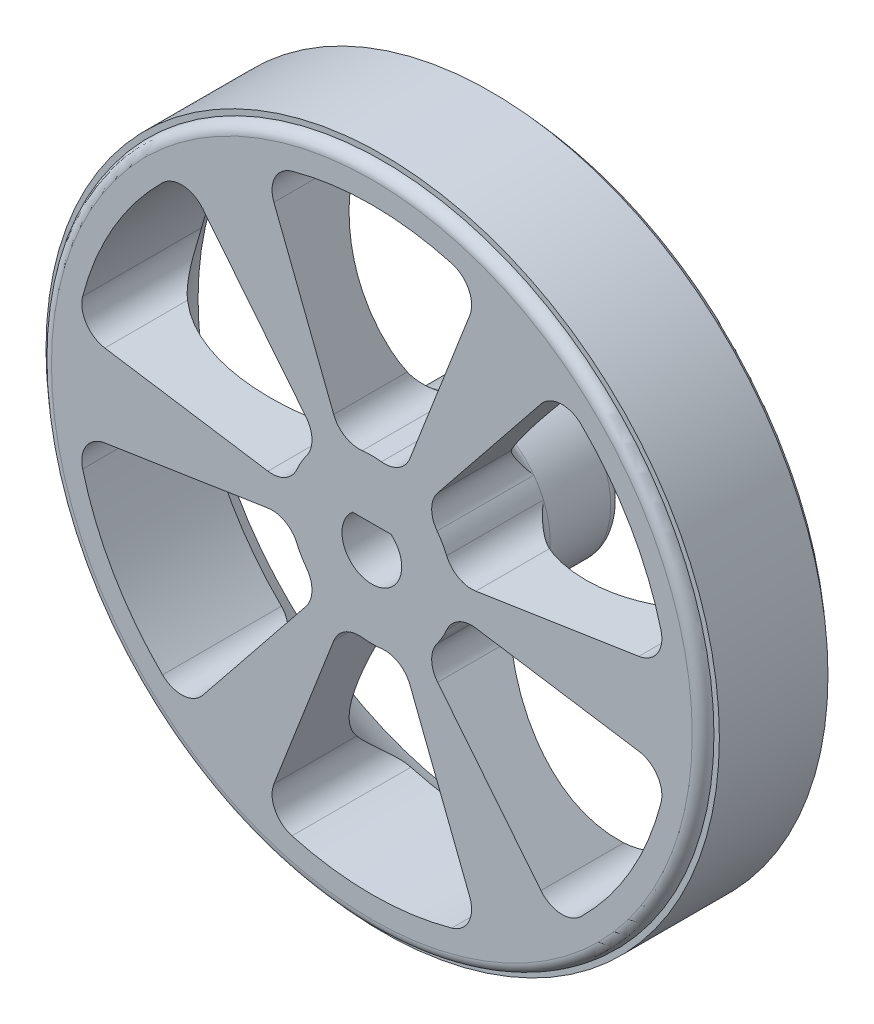
from build123d import *

# Parameters (mm, degrees)
ENL_V_MAT_EXTRU_1_DEPTH      = 46.83393939
ENL_V_MAT_EXTRU_1_DEPTH_BACK = 46.83393939
ESQUISSE3_OUTSIDE_W          = 80.53
ESQUISSE3_OUTSIDE_H          = 80.53
ESQUISSE3_OUTSIDE_R          = 30.5
ENL_V_MAT_EXTRU_2_DEPTH      = 46.833939424
CONG_1_R                     = 1
CONG_2_R                     = 1
ESQUISSE5_W                  = 10
ESQUISSE5_H                  = 1
ESQUISSE6_R                  = 1.55
ENL_V_MAT_EXTRU_3_DEPTH      = 10
ENL_V_START                  = 4.6
ENL_V_MAT_EXTRU_4_DEPTH      = 10


with BuildPart() as part:
    # Esquisse2 → Révolution1 (revolve)
    with BuildSketch(Plane(origin=(0, 0, 0), x_dir=(0, 0, -1), z_dir=(1, 0, 0)), mode=Mode.PRIVATE) as r_volution1_sk:
        with BuildLine():
            Line((0, 30.5), (0, 0))
            Line((0, 0), (15.5, 0))
            Line((15.5, 0), (15.5, 7.5))
            Line((15.5, 7.5), (8.918042609, 7.5))
            add(Edge.make_bspline(
                [(12, 28), (0.252176706, 23.0109808), (6.249286055, 7.481683521), (8.918042609, 7.5)],
                knots=[0, 0, 0, 0, 1, 1, 1, 1], degree=3))
            Line((12, 28), (12, 30.5))
            Line((12, 30.5), (11, 30.5))
            Line((11, 30.5), (11, 30))
            Line((11, 30), (1, 30))
            Line((1, 30), (1, 30.5))
            Line((1, 30.5), (0, 30.5))
        make_face()
    revolve(r_volution1_sk.sketch.rotate(Axis((0, 0, -15.5), (0, 0, 1)), 90), axis=Axis((0, 0, -15.5), (0, 0, 1)))

    # Esquisse3 outside → Enlèv. mat.-Extru.1 (cut, two sides: drawn at the far end of the back side and taken through both)
    # profile 1 of 7: a face of its own
    with BuildSketch(Plane.XY.offset(-ENL_V_MAT_EXTRU_1_DEPTH_BACK)):
        Rectangle(ESQUISSE3_OUTSIDE_W, ESQUISSE3_OUTSIDE_H)
        with Locations(Location((0, 0, 0), (0, 0, 180))):
            Circle(ESQUISSE3_OUTSIDE_R, mode=Mode.SUBTRACT)
    # profile 2 of 7: a face of its own
    with BuildSketch(Plane.XY.offset(-ENL_V_MAT_EXTRU_1_DEPTH_BACK)):
        with BuildLine():
            Line((-9.015532371, 23.183403031), (-3.509291216, 9.024127391))
            ThreePointArc((-3.509291216, 9.024127391), (-2.466446172, 7.787051594), (-0.884453657, 7.447666865))
            ThreePointArc((-0.884453657, 7.447666865), (0, 7.5), (0.884453657, 7.447666865))
            ThreePointArc((0.884453657, 7.447666865), (2.466446172, 7.787051594), (3.509291216, 9.024127391))
            Line((3.509291216, 9.024127391), (9.015532371, 23.183403031))
            ThreePointArc((9.015532371, 23.183403031), (8.920515519, 25.209659895), (7.354063967, 26.498447939))
            ThreePointArc((7.354063967, 26.498447939), (0, 27.5), (-7.354063967, 26.498447939))
            ThreePointArc((-7.354063967, 26.498447939), (-8.920515519, 25.209659895), (-9.015532371, 23.183403031))
        make_face()
    # profile 3 of 7: a face of its own
    with BuildSketch(Plane.XY.offset(-ENL_V_MAT_EXTRU_1_DEPTH_BACK)):
        with BuildLine():
            Line((9.569769175, 1.472928353), (24.585182156, 3.784021454))
            ThreePointArc((24.585182156, 3.784021454), (26.292463649, 4.879436894), (26.625361059, 6.880417753))
            ThreePointArc((26.625361059, 6.880417753), (23.815698604, 13.75), (19.271297092, 19.618030186))
            ThreePointArc((19.271297092, 19.618030186), (17.371948131, 20.330223002), (15.569649785, 19.399381577))
            Line((15.569649785, 19.399381577), (6.060477959, 7.551199037))
            ThreePointArc((6.060477959, 7.551199037), (5.510561415, 6.029530839), (6.007641875, 4.489792768))
            ThreePointArc((6.007641875, 4.489792768), (6.495190528, 3.75), (6.892095532, 2.957874097))
            ThreePointArc((6.892095532, 2.957874097), (7.977007587, 1.757520755), (9.569769175, 1.472928353))
        make_face()
    # profile 4 of 7: a face of its own
    with BuildSketch(Plane.XY.offset(-ENL_V_MAT_EXTRU_1_DEPTH_BACK)):
        with BuildLine():
            Line((6.060477959, -7.551199037), (15.569649785, -19.399381577))
            ThreePointArc((15.569649785, -19.399381577), (17.371948131, -20.330223002), (19.271297092, -19.618030186))
            ThreePointArc((19.271297092, -19.618030186), (23.815698604, -13.75), (26.625361059, -6.880417753))
            ThreePointArc((26.625361059, -6.880417753), (26.292463649, -4.879436894), (24.585182156, -3.784021454))
            Line((24.585182156, -3.784021454), (9.569769175, -1.472928353))
            ThreePointArc((9.569769175, -1.472928353), (7.977007587, -1.757520755), (6.892095532, -2.957874097))
            ThreePointArc((6.892095532, -2.957874097), (6.495190528, -3.75), (6.007641875, -4.489792768))
            ThreePointArc((6.007641875, -4.489792768), (5.510561415, -6.029530839), (6.060477959, -7.551199037))
        make_face()
    # profile 5 of 7: a face of its own
    with BuildSketch(Plane.XY.offset(-ENL_V_MAT_EXTRU_1_DEPTH_BACK)):
        with BuildLine():
            Line((-3.509291216, -9.024127391), (-9.015532371, -23.183403031))
            ThreePointArc((-9.015532371, -23.183403031), (-8.920515519, -25.209659895), (-7.354063967, -26.498447939))
            ThreePointArc((-7.354063967, -26.498447939), (0, -27.5), (7.354063967, -26.498447939))
            ThreePointArc((7.354063967, -26.498447939), (8.920515519, -25.209659895), (9.015532371, -23.183403031))
            Line((9.015532371, -23.183403031), (3.509291216, -9.024127391))
            ThreePointArc((3.509291216, -9.024127391), (2.466446172, -7.787051594), (0.884453657, -7.447666865))
            ThreePointArc((0.884453657, -7.447666865), (0, -7.5), (-0.884453657, -7.447666865))
            ThreePointArc((-0.884453657, -7.447666865), (-2.466446172, -7.787051594), (-3.509291216, -9.024127391))
        make_face()
    # profile 6 of 7: a face of its own
    with BuildSketch(Plane.XY.offset(-ENL_V_MAT_EXTRU_1_DEPTH_BACK)):
        with BuildLine():
            Line((-9.569769175, -1.472928353), (-24.585182156, -3.784021454))
            ThreePointArc((-24.585182156, -3.784021454), (-26.292463649, -4.879436894), (-26.625361059, -6.880417753))
            ThreePointArc((-26.625361059, -6.880417753), (-23.815698604, -13.75), (-19.271297092, -19.618030186))
            ThreePointArc((-19.271297092, -19.618030186), (-17.371948131, -20.330223002), (-15.569649785, -19.399381577))
            Line((-15.569649785, -19.399381577), (-6.060477959, -7.551199037))
            ThreePointArc((-6.060477959, -7.551199037), (-5.510561415, -6.029530839), (-6.007641875, -4.489792768))
            ThreePointArc((-6.007641875, -4.489792768), (-6.495190528, -3.75), (-6.892095532, -2.957874097))
            ThreePointArc((-6.892095532, -2.957874097), (-7.977007587, -1.757520755), (-9.569769175, -1.472928353))
        make_face()
    # profile 7 of 7: a face of its own
    with BuildSketch(Plane.XY.offset(-ENL_V_MAT_EXTRU_1_DEPTH_BACK)):
        with BuildLine():
            Line((-6.060477959, 7.551199037), (-15.569649785, 19.399381577))
            ThreePointArc((-15.569649785, 19.399381577), (-17.371948131, 20.330223002), (-19.271297092, 19.618030186))
            ThreePointArc((-19.271297092, 19.618030186), (-23.815698604, 13.75), (-26.625361059, 6.880417753))
            ThreePointArc((-26.625361059, 6.880417753), (-26.292463649, 4.879436894), (-24.585182156, 3.784021454))
            Line((-24.585182156, 3.784021454), (-9.569769175, 1.472928353))
            ThreePointArc((-9.569769175, 1.472928353), (-7.977007587, 1.757520755), (-6.892095532, 2.957874097))
            ThreePointArc((-6.892095532, 2.957874097), (-6.495190528, 3.75), (-6.007641875, 4.489792768))
            ThreePointArc((-6.007641875, 4.489792768), (-5.510561415, 6.029530839), (-6.060477959, 7.551199037))
        make_face()
    extrude(amount=ENL_V_MAT_EXTRU_1_DEPTH + ENL_V_MAT_EXTRU_1_DEPTH_BACK, mode=Mode.SUBTRACT)

    # Esquisse4 → Enlèv. mat.-Extru.2 (cut, through all)
    with BuildSketch(Plane(origin=(0, 0, -15.5), x_dir=(-1, 0, 0), z_dir=(0, 0, -1))):
        with BuildLine():
            Line((-1.770155924, 2.104530352), (1.770155924, 2.104530352))
            ThreePointArc((1.770155924, 2.104530352), (0, -2.75), (-1.770155924, 2.104530352))
        make_face()
    extrude(amount=-ENL_V_MAT_EXTRU_2_DEPTH, mode=Mode.SUBTRACT)

    # Congé1
    cong_1_edges = [part.edges().sort_by_distance(p)[0] for p in [
        (7.5, 0, -15.5),
    ]]
    fillet(cong_1_edges, radius=CONG_1_R)

    # Congé2
    cong_2_edges = [part.edges().sort_by_distance(p)[0] for p in [
        (30.5, 0, 0),
        (30.5, 0, -12),
    ]]
    fillet(cong_2_edges, radius=CONG_2_R - 0.0001)  # a hair under: the kernel refuses the full size

    # Esquisse5 → pneue (revolve)
    with BuildSketch(Plane(origin=(0, 0, 0), x_dir=(0, 0, -1), z_dir=(1, 0, 0)), mode=Mode.PRIVATE) as pneue_sk:
        with Locations((6, 30.5)):
            Rectangle(ESQUISSE5_W, ESQUISSE5_H)
    revolve(pneue_sk.sketch.rotate(Axis((0, 0, 10.788834097), (0, 0, -1)), 90), axis=Axis((0, 0, 10.788834097), (0, 0, -1)))

    # Esquisse6 → Enlèv. mat.-Extru.3 (cut)
    with BuildSketch(Plane(origin=(0, 0, 0), x_dir=(1, 0, 0), z_dir=(0, 1, 0))):
        with Locations(Location((0, 13, 0), (0, 0, 90))):
            Circle(ESQUISSE6_R)
    extrude(amount=ENL_V_MAT_EXTRU_3_DEPTH, mode=Mode.SUBTRACT)

    # Esquisse7 → Enlèv. mat.-Extru.4 (cut)
    with BuildSketch(Plane(origin=(0, 0, 0), x_dir=(1, 0, 0), z_dir=(0, 1, 0)).offset(ENL_V_START)):
        with BuildLine():
            Line((-3.5, 15.5), (-3.5, 13))
            ThreePointArc((-3.5, 13), (0, 9.5), (3.5, 13))
            Line((3.5, 13), (3.5, 15.5))
            Line((3.5, 15.5), (-3.5, 15.5))
        make_face()
    extrude(amount=ENL_V_MAT_EXTRU_4_DEPTH, mode=Mode.SUBTRACT)


solid = part.part
